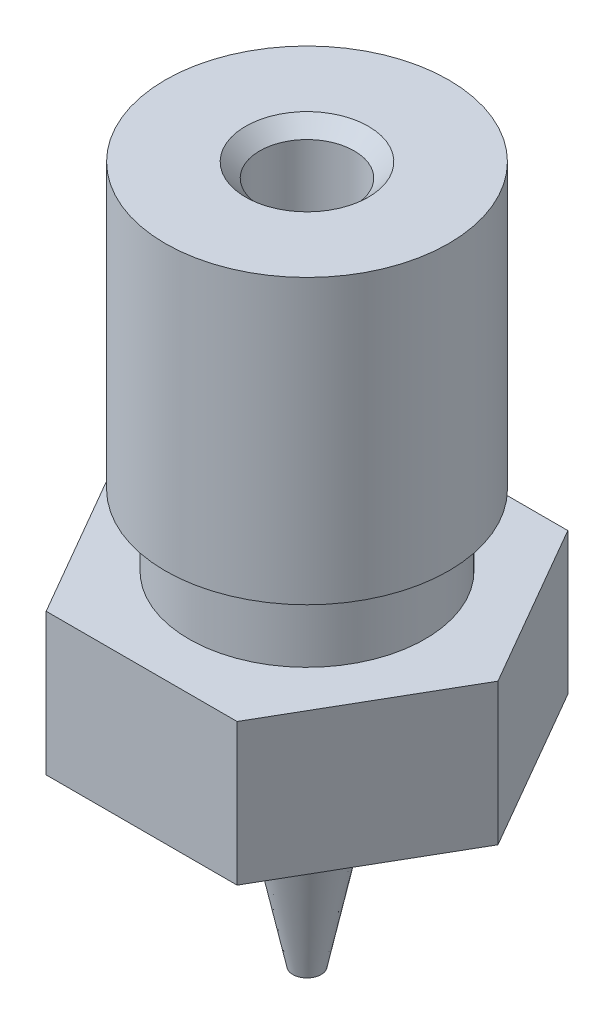
from build123d import *

# Parameters (mm, degrees)
BOSS_EXTRUDE1_START = -3
BOSS_EXTRUDE1_DEPTH = 3


with BuildPart() as part:
    # Sketch1 → Revolve1 (revolve)
    with BuildSketch(Plane.XY):
        Polygon((0, 0), (0.5, 0), (1.900415076, 2), (3.5, 2), (3.5, 5), (2.5, 5), (2.5, 6.5), (3, 6.5), (3, 12.5), (0, 12.5), align=None)
    revolve(axis=Axis((0, -1.1291331, 0), (0, -1, 0)))

    # Sketch2 → Cut-Revolve1 (revolve, cut)
    with BuildSketch(Plane.XY):
        Polygon((0, 12.5), (1.3, 12.5), (1, 12.2), (1, 1.985640646), (0.2, 0.6), (0.2, 0), (0, 0), align=None)
    revolve(axis=Axis((0, 0, 0), (0, 1, 0)), mode=Mode.SUBTRACT)

    # Sketch3 → Boss-Extrude1 (add)
    with BuildSketch(Plane.XZ.offset(-2).offset(BOSS_EXTRUDE1_START)):
        with BuildLine():
            Line((3.031088915, -1.749999996), (4.041451884, 0))
            Line((4.041451884, 0), (3.031088922, 1.749999985))
            ThreePointArc((3.031088922, 1.749999985), (3.5, -6e-09), (3.031088915, -1.749999996))
        make_face()
        with BuildLine():
            ThreePointArc((0, 3.5), (1.750000007, 3.031088909), (3.031088922, 1.749999985))
            Line((3.031088922, 1.749999985), (2.020725942, 3.5))
            Line((2.020725942, 3.5), (0, 3.5))
        make_face()
        with BuildLine():
            Line((2.020725942, -3.5), (3.031088915, -1.749999996))
            ThreePointArc((3.031088915, -1.749999996), (1.750000009, -3.031088908), (1.6e-08, -3.5))
            Line((1.6e-08, -3.5), (2.020725942, -3.5))
        make_face()
        with BuildLine():
            ThreePointArc((-3.031088921, 1.749999986), (-1.750000007, 3.031088909), (0, 3.5))
            Line((0, 3.5), (-2.020725942, 3.5))
            Line((-2.020725942, 3.5), (-3.031088921, 1.749999986))
        make_face()
        with BuildLine():
            Line((-2.020725942, -3.5), (1.6e-08, -3.5))
            ThreePointArc((1.6e-08, -3.5), (-1.75, -3.031088913), (-3.031088921, -1.749999986))
            Line((-3.031088921, -1.749999986), (-2.020725942, -3.5))
        make_face()
        with BuildLine():
            ThreePointArc((-3.031088921, -1.749999986), (-3.5, 0), (-3.031088921, 1.749999986))
            Line((-3.031088921, 1.749999986), (-4.041451884, 0))
            Line((-4.041451884, 0), (-3.031088921, -1.749999986))
        make_face()
    extrude(amount=BOSS_EXTRUDE1_DEPTH)

    # Sketch4 → Revolve2 (revolve)
    with BuildSketch(Plane.XY):
        Polygon((0, -2.25), (0.3, -2.25), (0.885114146, 0.55), (1.3, 0.55), (1.3, 2), (0, 2), align=None)
    revolve(axis=Axis((0, 2, 0), (0, -1, 0)))


solid = part.part
